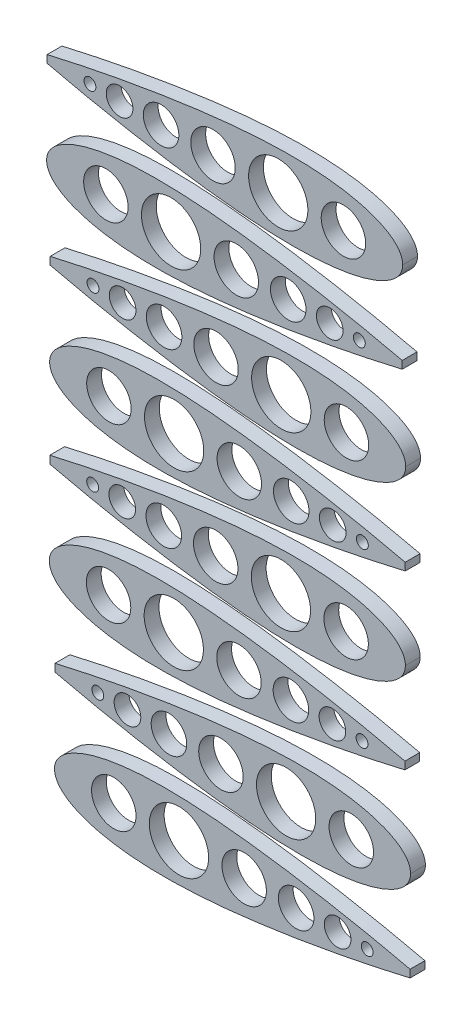
from build123d import *

# Parameters (mm, degrees)
SKETCH3_R             = 3
SKETCH3_R_2           = 2.4
SKETCH3_R_3           = 1.8
SKETCH3_R_4           = 4
SKETCH3_R_5           = 0.8
BOSS_EXTRUDE1_DEPTH   = 1
BOSS_EXTRUDE1_2_DEPTH = 1
BOSS_EXTRUDE1_3_DEPTH = 1
BOSS_EXTRUDE1_4_DEPTH = 1
BOSS_EXTRUDE1_5_DEPTH = 1
BOSS_EXTRUDE1_6_DEPTH = 1
BOSS_EXTRUDE1_7_DEPTH = 1
BOSS_EXTRUDE1_8_DEPTH = 1


with BuildPart() as part:
    # Sketch3 → Boss-Extrude1 (new, symmetric)
    with BuildSketch(Plane.XY):
        with BuildLine():
            Line((45.917800755, 0.750362197), (45.919419542, -0.277439389))
            add(Edge.make_bspline(
                [(-2.082199245, 0.160860129), (-2.081952194, 0.071640867), (-2.07374013, -0.084768844), (-2.041891142, -0.310220538), (-1.961048117, -0.604515456), (-1.847691772, -0.885275938), (-1.686732692, -1.179995064), (-1.462400089, -1.497179241), (-1.152579712, -1.842870259), (-0.722454312, -2.224944594), (-0.121936459, -2.648658184), (0.698645093, -3.103588606), (1.844645331, -3.594556504), (3.285096182, -4.051191861), (5.371913829, -4.526436716), (8.086354681, -4.894221024), (11.280495111, -5.076355831), (14.941589644, -5.044041079), (18.166549217, -4.858899542), (20.927079884, -4.614673365), (23.676919792, -4.315349446), (25.972237461, -4.022299468), (28.246613105, -3.698172579), (30.998270395, -3.265896123), (33.245205712, -2.887262497), (35.562136665, -2.465232179), (38.209721056, -1.95929534), (40.601787622, -1.467978059), (42.634192546, -1.035887238), (44.696860353, -0.564398536), (45.5105022, -0.374431444), (45.919419542, -0.277439389)],
                knots=[0, 0, 0, 0, 0, 0.006442135, 0.01132528, 0.01640633, 0.022022241, 0.028284763, 0.035552492, 0.04443509, 0.055515051, 0.069795494, 0.08858812, 0.112149618, 0.145519971, 0.178890371, 0.243189394, 0.309930212, 0.376671029, 0.443411848, 0.476782258, 0.510152669, 0.576893487, 0.610263899, 0.64363431, 0.710375129, 0.743745539, 0.77711595, 0.843856766, 0.877227178, 0.910597591, 0.910597591, 0.910597591, 0.910597591, 0.910597591], degree=4))
            add(Edge.make_bspline(
                [(-2.082199245, 0.160860129), (-2.082233235, 0.250079726), (-2.074513901, 0.406514529), (-2.043375242, 0.632065428), (-1.963459645, 0.926613542), (-1.850988256, 1.207729702), (-1.690958337, 1.502954386), (-1.467625975, 1.820843636), (-1.158896059, 2.16750887), (-0.729976324, 2.550936201), (-0.130796145, 2.976539316), (0.688348309, 3.434052306), (1.832796316, 3.92862766), (3.271801623, 4.389798161), (5.357111899, 4.871614117), (8.070380766, 5.247947068), (11.263931626, 5.440142488), (14.925109787, 5.419360316), (18.150636555, 5.244378295), (20.911922837, 5.00884898), (23.662691969, 4.71818852), (25.958921356, 4.432370228), (28.234306714, 4.115409213), (30.987312019, 3.691802601), (33.235428882, 3.320248681), (35.553677732, 2.905518772), (38.202842685, 2.407924313), (40.596445029, 1.924144461), (42.630200953, 1.498457843), (44.694343712, 1.033468868), (45.508579917, 0.846065684), (45.917800755, 0.750362197)],
                knots=[0, 0, 0, 0, 0, 0.006442135, 0.01132528, 0.01640633, 0.022022241, 0.028284763, 0.035552492, 0.04443509, 0.055515051, 0.069795494, 0.08858812, 0.112149618, 0.145519971, 0.178890371, 0.243189394, 0.309930212, 0.376671029, 0.443411848, 0.476782258, 0.510152669, 0.576893487, 0.610263899, 0.64363431, 0.710375129, 0.743745539, 0.77711595, 0.843856766, 0.877227178, 0.910597591, 0.910597591, 0.910597591, 0.910597591, 0.910597591], degree=4))
        make_face()
        with Locations((5.917800755, 0.170201873)):
            Circle(SKETCH3_R, mode=Mode.SUBTRACT)
        with Locations((23.517800755, 0.19075371)):
            Circle(SKETCH3_R, mode=Mode.SUBTRACT)
        with Locations((30.531078192, 0.19894324)):
            Circle(SKETCH3_R_2, mode=Mode.SUBTRACT)
        with Locations((36.131078192, 0.205482461)):
            Circle(SKETCH3_R_3, mode=Mode.SUBTRACT)
        with Locations((14.717800755, 0.180477791)):
            Circle(SKETCH3_R_4, mode=Mode.SUBTRACT)
        with Locations((40.131078192, 0.210153333)):
            Circle(SKETCH3_R_5, mode=Mode.SUBTRACT)
    extrude(amount=BOSS_EXTRUDE1_DEPTH, both=True)


with BuildPart() as body_2:
    # Sketch3 → Boss-Extrude1 2 (new, symmetric)
    with BuildSketch(Plane.XY):
        with BuildLine():
            Line((-2.019643238, 12.538517767), (-2.021262026, 11.510716181))
            add(Edge.make_bspline(
                [(45.980356762, 11.949015699), (45.98010971, 11.859796438), (45.971897646, 11.703386726), (45.940048659, 11.477935033), (45.859205633, 11.183640115), (45.745849288, 10.902879633), (45.584890208, 10.608160506), (45.360557605, 10.290976329), (45.050737228, 9.945285311), (44.620611829, 9.563210977), (44.020093975, 9.139497386), (43.199512423, 8.684566965), (42.053512186, 8.193599066), (40.613061334, 7.736963709), (38.526243688, 7.261718855), (35.811802835, 6.893934546), (32.617662406, 6.71179974), (28.956567872, 6.744114492), (25.731608299, 6.929256029), (22.971077632, 7.173482206), (20.221237725, 7.472806125), (17.925920056, 7.765856103), (15.651544412, 8.089982992), (12.899887122, 8.522259447), (10.652951805, 8.900893074), (8.336020852, 9.322923391), (5.68843646, 9.82886023), (3.296369895, 10.320177511), (1.26396497, 10.752268333), (-0.798702837, 11.223757035), (-1.612344683, 11.413724126), (-2.021262026, 11.510716181)],
                knots=[0, 0, 0, 0, 0, 0.006442135, 0.01132528, 0.01640633, 0.022022241, 0.028284763, 0.035552492, 0.04443509, 0.055515051, 0.069795494, 0.08858812, 0.112149618, 0.145519971, 0.178890371, 0.243189394, 0.309930212, 0.376671029, 0.443411848, 0.476782258, 0.510152669, 0.576893487, 0.610263899, 0.64363431, 0.710375129, 0.743745539, 0.77711595, 0.843856766, 0.877227178, 0.910597591, 0.910597591, 0.910597591, 0.910597591, 0.910597591], degree=4))
            add(Edge.make_bspline(
                [(45.980356762, 11.949015699), (45.980390752, 12.038235297), (45.972671418, 12.1946701), (45.941532759, 12.420220999), (45.861617162, 12.714769112), (45.749145772, 12.995885272), (45.589115854, 13.291109956), (45.365783492, 13.608999206), (45.057053575, 13.95566444), (44.628133841, 14.339091771), (44.028953661, 14.764694886), (43.209809208, 15.222207876), (42.065361201, 15.716783231), (40.626355894, 16.177953731), (38.541045618, 16.659769687), (35.82777675, 17.036102638), (32.634225891, 17.228298059), (28.973047729, 17.207515886), (25.747520962, 17.032533865), (22.98623468, 16.79700455), (20.235465547, 16.50634409), (17.93923616, 16.220525799), (15.663850803, 15.903564783), (12.910845498, 15.479958171), (10.662728635, 15.108404252), (8.344479784, 14.693674342), (5.695314831, 14.196079884), (3.301712488, 13.712300031), (1.267956564, 13.286613413), (-0.796186196, 12.821624438), (-1.6104224, 12.634221254), (-2.019643238, 12.538517767)],
                knots=[0, 0, 0, 0, 0, 0.006442135, 0.01132528, 0.01640633, 0.022022241, 0.028284763, 0.035552492, 0.04443509, 0.055515051, 0.069795494, 0.08858812, 0.112149618, 0.145519971, 0.178890371, 0.243189394, 0.309930212, 0.376671029, 0.443411848, 0.476782258, 0.510152669, 0.576893487, 0.610263899, 0.64363431, 0.710375129, 0.743745539, 0.77711595, 0.843856766, 0.877227178, 0.910597591, 0.910597591, 0.910597591, 0.910597591, 0.910597591], degree=4))
        make_face()
        with Locations((3.767079325, 11.998308903)):
            Circle(SKETCH3_R_5, mode=Mode.SUBTRACT)
        with Locations((29.180356762, 11.968633362)):
            Circle(SKETCH3_R_4, mode=Mode.SUBTRACT)
        with Locations((7.767079325, 11.993638031)):
            Circle(SKETCH3_R_3, mode=Mode.SUBTRACT)
        with Locations((13.367079325, 11.987098811)):
            Circle(SKETCH3_R_2, mode=Mode.SUBTRACT)
        with Locations((20.380356762, 11.97890928)):
            Circle(SKETCH3_R, mode=Mode.SUBTRACT)
        with Locations((37.980356762, 11.958357443)):
            Circle(SKETCH3_R, mode=Mode.SUBTRACT)
    extrude(amount=BOSS_EXTRUDE1_2_DEPTH, both=True)


with BuildPart() as body_3:
    # Sketch3 → Boss-Extrude1 3 (new, symmetric)
    with BuildSketch(Plane.XY):
        with BuildLine():
            Line((45.216926206, 24.72516597), (45.218544993, 23.697364385))
            add(Edge.make_bspline(
                [(-2.783073794, 24.135663903), (-2.782826743, 24.046444641), (-2.774614679, 23.89003493), (-2.742765691, 23.664583236), (-2.661922666, 23.370288318), (-2.548566321, 23.089527836), (-2.387607241, 22.79480871), (-2.163274638, 22.477624532), (-1.853454261, 22.131933515), (-1.423328861, 21.74985918), (-0.822811008, 21.326145589), (-0.002229456, 20.871215168), (1.143770782, 20.380247269), (2.584221633, 19.923611913), (4.67103928, 19.448367058), (7.385480132, 19.08058275), (10.579620562, 18.898447943), (14.240715095, 18.930762695), (17.465674669, 19.115904232), (20.226205335, 19.360130409), (22.976045243, 19.659454328), (25.271362912, 19.952504306), (27.545738556, 20.276631195), (30.297395846, 20.70890765), (32.544331163, 21.087541277), (34.861262116, 21.509571595), (37.508846507, 22.015508434), (39.900913073, 22.506825715), (41.933317997, 22.938916536), (43.995985804, 23.410405238), (44.809627651, 23.60037233), (45.218544993, 23.697364385)],
                knots=[0, 0, 0, 0, 0, 0.006442135, 0.01132528, 0.01640633, 0.022022241, 0.028284763, 0.035552492, 0.04443509, 0.055515051, 0.069795494, 0.08858812, 0.112149618, 0.145519971, 0.178890371, 0.243189394, 0.309930212, 0.376671029, 0.443411848, 0.476782258, 0.510152669, 0.576893487, 0.610263899, 0.64363431, 0.710375129, 0.743745539, 0.77711595, 0.843856766, 0.877227178, 0.910597591, 0.910597591, 0.910597591, 0.910597591, 0.910597591], degree=4))
            add(Edge.make_bspline(
                [(-2.783073794, 24.135663903), (-2.783107784, 24.2248835), (-2.77538845, 24.381318303), (-2.744249791, 24.606869202), (-2.664334194, 24.901417315), (-2.551862805, 25.182533476), (-2.391832886, 25.47775816), (-2.168500524, 25.795647409), (-1.859770608, 26.142312644), (-1.430850873, 26.525739974), (-0.831670694, 26.95134309), (-0.01252624, 27.408856079), (1.131921767, 27.903431434), (2.570927074, 28.364601934), (4.65623735, 28.84641789), (7.369506217, 29.222750841), (10.563057077, 29.414946262), (14.224235238, 29.39416409), (17.449762006, 29.219182068), (20.211048288, 28.983652753), (22.96181742, 28.692992293), (25.258046807, 28.407174002), (27.533432165, 28.090212986), (30.28643747, 27.666606375), (32.534554333, 27.295052455), (34.852803183, 26.880322546), (37.501968136, 26.382728087), (39.89557048, 25.898948235), (41.929326404, 25.473261617), (43.993469163, 25.008272641), (44.807705368, 24.820869458), (45.216926206, 24.72516597)],
                knots=[0, 0, 0, 0, 0, 0.006442135, 0.01132528, 0.01640633, 0.022022241, 0.028284763, 0.035552492, 0.04443509, 0.055515051, 0.069795494, 0.08858812, 0.112149618, 0.145519971, 0.178890371, 0.243189394, 0.309930212, 0.376671029, 0.443411848, 0.476782258, 0.510152669, 0.576893487, 0.610263899, 0.64363431, 0.710375129, 0.743745539, 0.77711595, 0.843856766, 0.877227178, 0.910597591, 0.910597591, 0.910597591, 0.910597591, 0.910597591], degree=4))
        make_face()
        with Locations((5.216926206, 24.145005647)):
            Circle(SKETCH3_R, mode=Mode.SUBTRACT)
        with Locations((22.816926206, 24.165557483)):
            Circle(SKETCH3_R, mode=Mode.SUBTRACT)
        with Locations((29.830203643, 24.173747014)):
            Circle(SKETCH3_R_2, mode=Mode.SUBTRACT)
        with Locations((35.430203643, 24.180286235)):
            Circle(SKETCH3_R_3, mode=Mode.SUBTRACT)
        with Locations((14.016926206, 24.155281565)):
            Circle(SKETCH3_R_4, mode=Mode.SUBTRACT)
        with Locations((39.430203643, 24.184957107)):
            Circle(SKETCH3_R_5, mode=Mode.SUBTRACT)
    extrude(amount=BOSS_EXTRUDE1_3_DEPTH, both=True)


with BuildPart() as body_4:
    # Sketch3 → Boss-Extrude1 4 (new, symmetric)
    with BuildSketch(Plane.XY):
        with BuildLine():
            Line((-2.720517787, 36.513321541), (-2.722136575, 35.485519955))
            add(Edge.make_bspline(
                [(45.279482213, 35.923819473), (45.279235161, 35.834600211), (45.271023097, 35.6781905), (45.23917411, 35.452738807), (45.158331084, 35.158443888), (45.044974739, 34.877683407), (44.884015659, 34.58296428), (44.659683056, 34.265780103), (44.349862679, 33.920089085), (43.91973728, 33.538014751), (43.319219426, 33.11430116), (42.498637874, 32.659370738), (41.352637637, 32.16840284), (39.912186785, 31.711767483), (37.825369139, 31.236522629), (35.110928287, 30.86873832), (31.916787857, 30.686603513), (28.255693323, 30.718918265), (25.03073375, 30.904059803), (22.270203083, 31.148285979), (19.520363176, 31.447609898), (17.225045507, 31.740659876), (14.950669863, 32.064786765), (12.199012573, 32.497063221), (9.952077256, 32.875696848), (7.635146303, 33.297727165), (4.987561911, 33.803664004), (2.595495346, 34.294981285), (0.563090421, 34.727072106), (-1.499577386, 35.198560808), (-2.313219232, 35.3885279), (-2.722136575, 35.485519955)],
                knots=[0, 0, 0, 0, 0, 0.006442135, 0.01132528, 0.01640633, 0.022022241, 0.028284763, 0.035552492, 0.04443509, 0.055515051, 0.069795494, 0.08858812, 0.112149618, 0.145519971, 0.178890371, 0.243189394, 0.309930212, 0.376671029, 0.443411848, 0.476782258, 0.510152669, 0.576893487, 0.610263899, 0.64363431, 0.710375129, 0.743745539, 0.77711595, 0.843856766, 0.877227178, 0.910597591, 0.910597591, 0.910597591, 0.910597591, 0.910597591], degree=4))
            add(Edge.make_bspline(
                [(45.279482213, 35.923819473), (45.279516203, 36.01303907), (45.271796869, 36.169473873), (45.24065821, 36.395024773), (45.160742613, 36.689572886), (45.048271223, 36.970689046), (44.888241305, 37.26591373), (44.664908943, 37.58380298), (44.356179026, 37.930468214), (43.927259292, 38.313895545), (43.328079112, 38.73949866), (42.508934659, 39.19701165), (41.364486652, 39.691587005), (39.925481345, 40.152757505), (37.840171069, 40.634573461), (35.126902201, 41.010906412), (31.933351342, 41.203101832), (28.27217318, 41.18231966), (25.046646413, 41.007337639), (22.285360131, 40.771808324), (19.534590998, 40.481147864), (17.238361611, 40.195329572), (14.962976254, 39.878368557), (12.209970949, 39.454761945), (9.961854086, 39.083208026), (7.643605235, 38.668478116), (4.994440282, 38.170883657), (2.600837939, 37.687103805), (0.567082015, 37.261417187), (-1.497060745, 36.796428212), (-2.311296949, 36.609025028), (-2.720517787, 36.513321541)],
                knots=[0, 0, 0, 0, 0, 0.006442135, 0.01132528, 0.01640633, 0.022022241, 0.028284763, 0.035552492, 0.04443509, 0.055515051, 0.069795494, 0.08858812, 0.112149618, 0.145519971, 0.178890371, 0.243189394, 0.309930212, 0.376671029, 0.443411848, 0.476782258, 0.510152669, 0.576893487, 0.610263899, 0.64363431, 0.710375129, 0.743745539, 0.77711595, 0.843856766, 0.877227178, 0.910597591, 0.910597591, 0.910597591, 0.910597591, 0.910597591], degree=4))
        make_face()
        with Locations((3.066204776, 35.973112677)):
            Circle(SKETCH3_R_5, mode=Mode.SUBTRACT)
        with Locations((28.479482213, 35.943437135)):
            Circle(SKETCH3_R_4, mode=Mode.SUBTRACT)
        with Locations((7.066204776, 35.968441805)):
            Circle(SKETCH3_R_3, mode=Mode.SUBTRACT)
        with Locations((12.666204776, 35.961902584)):
            Circle(SKETCH3_R_2, mode=Mode.SUBTRACT)
        with Locations((19.679482213, 35.953713054)):
            Circle(SKETCH3_R, mode=Mode.SUBTRACT)
        with Locations((37.279482213, 35.933161217)):
            Circle(SKETCH3_R, mode=Mode.SUBTRACT)
    extrude(amount=BOSS_EXTRUDE1_4_DEPTH, both=True)


with BuildPart() as body_5:
    # Sketch3 → Boss-Extrude1 5 (new, symmetric)
    with BuildSketch(Plane.XY):
        with BuildLine():
            Line((45.26192229, 47.996607663), (45.263541077, 46.968806077))
            add(Edge.make_bspline(
                [(-2.73807771, 47.407105596), (-2.737830659, 47.317886334), (-2.729618595, 47.161476623), (-2.697769607, 46.936024929), (-2.616926582, 46.641730011), (-2.503570237, 46.360969529), (-2.342611157, 46.066250403), (-2.118278554, 45.749066225), (-1.808458177, 45.403375208), (-1.378332777, 45.021300873), (-0.777814924, 44.597587282), (0.042766628, 44.142656861), (1.188766866, 43.651688962), (2.629217717, 43.195053606), (4.716035364, 42.719808751), (7.430476216, 42.352024443), (10.624616646, 42.169889636), (14.285711179, 42.202204388), (17.510670752, 42.387345925), (20.271201419, 42.631572102), (23.021041327, 42.930896021), (25.316358996, 43.223945999), (27.59073464, 43.548072888), (30.34239193, 43.980349343), (32.589327247, 44.35898297), (34.9062582, 44.781013288), (37.553842591, 45.286950127), (39.945909157, 45.778267408), (41.978314081, 46.210358229), (44.040981888, 46.681846931), (44.854623735, 46.871814022), (45.263541077, 46.968806077)],
                knots=[0, 0, 0, 0, 0, 0.006442135, 0.01132528, 0.01640633, 0.022022241, 0.028284763, 0.035552492, 0.04443509, 0.055515051, 0.069795494, 0.08858812, 0.112149618, 0.145519971, 0.178890371, 0.243189394, 0.309930212, 0.376671029, 0.443411848, 0.476782258, 0.510152669, 0.576893487, 0.610263899, 0.64363431, 0.710375129, 0.743745539, 0.77711595, 0.843856766, 0.877227178, 0.910597591, 0.910597591, 0.910597591, 0.910597591, 0.910597591], degree=4))
            add(Edge.make_bspline(
                [(-2.73807771, 47.407105596), (-2.7381117, 47.496325193), (-2.730392366, 47.652759996), (-2.699253707, 47.878310895), (-2.61933811, 48.172859008), (-2.506866721, 48.453975169), (-2.346836802, 48.749199853), (-2.12350444, 49.067089102), (-1.814774524, 49.413754337), (-1.38585479, 49.797181667), (-0.78667461, 50.222784783), (0.032469844, 50.680297772), (1.17691785, 51.174873127), (2.615923158, 51.636043627), (4.701233434, 52.117859583), (7.414502301, 52.494192534), (10.608053161, 52.686387955), (14.269231322, 52.665605783), (17.49475809, 52.490623761), (20.256044372, 52.255094446), (23.006813504, 51.964433986), (25.303042891, 51.678615695), (27.578428249, 51.361654679), (30.331433554, 50.938048068), (32.579550417, 50.566494148), (34.897799267, 50.151764239), (37.54696422, 49.65416978), (39.940566564, 49.170389928), (41.974322488, 48.74470331), (44.038465247, 48.279714334), (44.852701452, 48.092311151), (45.26192229, 47.996607663)],
                knots=[0, 0, 0, 0, 0, 0.006442135, 0.01132528, 0.01640633, 0.022022241, 0.028284763, 0.035552492, 0.04443509, 0.055515051, 0.069795494, 0.08858812, 0.112149618, 0.145519971, 0.178890371, 0.243189394, 0.309930212, 0.376671029, 0.443411848, 0.476782258, 0.510152669, 0.576893487, 0.610263899, 0.64363431, 0.710375129, 0.743745539, 0.77711595, 0.843856766, 0.877227178, 0.910597591, 0.910597591, 0.910597591, 0.910597591, 0.910597591], degree=4))
        make_face()
        with Locations((5.26192229, 47.41644734)):
            Circle(SKETCH3_R, mode=Mode.SUBTRACT)
        with Locations((22.86192229, 47.436999176)):
            Circle(SKETCH3_R, mode=Mode.SUBTRACT)
        with Locations((29.875199727, 47.445188707)):
            Circle(SKETCH3_R_2, mode=Mode.SUBTRACT)
        with Locations((35.475199727, 47.451727928)):
            Circle(SKETCH3_R_3, mode=Mode.SUBTRACT)
        with Locations((14.06192229, 47.426723258)):
            Circle(SKETCH3_R_4, mode=Mode.SUBTRACT)
        with Locations((39.475199727, 47.4563988)):
            Circle(SKETCH3_R_5, mode=Mode.SUBTRACT)
    extrude(amount=BOSS_EXTRUDE1_5_DEPTH, both=True)


with BuildPart() as body_6:
    # Sketch3 → Boss-Extrude1 6 (new, symmetric)
    with BuildSketch(Plane.XY):
        with BuildLine():
            Line((-2.675521703, 59.784763234), (-2.677140491, 58.756961648))
            add(Edge.make_bspline(
                [(45.324478297, 59.195261166), (45.324231245, 59.106041904), (45.316019181, 58.949632193), (45.284170194, 58.724180499), (45.203327168, 58.429885581), (45.089970823, 58.1491251), (44.929011743, 57.854405973), (44.70467914, 57.537221796), (44.394858763, 57.191530778), (43.964733364, 56.809456443), (43.36421551, 56.385742853), (42.543633958, 55.930812431), (41.397633721, 55.439844533), (39.957182869, 54.983209176), (37.870365223, 54.507964321), (35.15592437, 54.140180013), (31.961783941, 53.958045206), (28.300689407, 53.990359958), (25.075729834, 54.175501495), (22.315199167, 54.419727672), (19.56535926, 54.719051591), (17.270041591, 55.012101569), (14.995665947, 55.336228458), (12.244008657, 55.768504914), (9.99707334, 56.147138541), (7.680142387, 56.569168858), (5.032557995, 57.075105697), (2.64049143, 57.566422978), (0.608086505, 57.998513799), (-1.454581302, 58.470002501), (-2.268223148, 58.659969593), (-2.677140491, 58.756961648)],
                knots=[0, 0, 0, 0, 0, 0.006442135, 0.01132528, 0.01640633, 0.022022241, 0.028284763, 0.035552492, 0.04443509, 0.055515051, 0.069795494, 0.08858812, 0.112149618, 0.145519971, 0.178890371, 0.243189394, 0.309930212, 0.376671029, 0.443411848, 0.476782258, 0.510152669, 0.576893487, 0.610263899, 0.64363431, 0.710375129, 0.743745539, 0.77711595, 0.843856766, 0.877227178, 0.910597591, 0.910597591, 0.910597591, 0.910597591, 0.910597591], degree=4))
            add(Edge.make_bspline(
                [(45.324478297, 59.195261166), (45.324512286, 59.284480763), (45.316792953, 59.440915566), (45.285654294, 59.666466465), (45.205738697, 59.961014579), (45.093267307, 60.242130739), (44.933237389, 60.537355423), (44.709905026, 60.855244673), (44.40117511, 61.201909907), (43.972255376, 61.585337238), (43.373075196, 62.010940353), (42.553930743, 62.468453343), (41.409482736, 62.963028698), (39.970477429, 63.424199198), (37.885167153, 63.906015154), (35.171898285, 64.282348105), (31.978347426, 64.474543525), (28.317169264, 64.453761353), (25.091642497, 64.278779332), (22.330356215, 64.043250017), (19.579587082, 63.752589557), (17.283357695, 63.466771265), (15.007972338, 63.14981025), (12.254967032, 62.726203638), (10.00685017, 62.354649719), (7.688601319, 61.939919809), (5.039436366, 61.44232535), (2.645834023, 60.958545498), (0.612078099, 60.53285888), (-1.452064661, 60.067869905), (-2.266300865, 59.880466721), (-2.675521703, 59.784763234)],
                knots=[0, 0, 0, 0, 0, 0.006442135, 0.01132528, 0.01640633, 0.022022241, 0.028284763, 0.035552492, 0.04443509, 0.055515051, 0.069795494, 0.08858812, 0.112149618, 0.145519971, 0.178890371, 0.243189394, 0.309930212, 0.376671029, 0.443411848, 0.476782258, 0.510152669, 0.576893487, 0.610263899, 0.64363431, 0.710375129, 0.743745539, 0.77711595, 0.843856766, 0.877227178, 0.910597591, 0.910597591, 0.910597591, 0.910597591, 0.910597591], degree=4))
        make_face()
        with Locations((3.11120086, 59.24455437)):
            Circle(SKETCH3_R_5, mode=Mode.SUBTRACT)
        with Locations((28.524478297, 59.214878828)):
            Circle(SKETCH3_R_4, mode=Mode.SUBTRACT)
        with Locations((7.11120086, 59.239883498)):
            Circle(SKETCH3_R_3, mode=Mode.SUBTRACT)
        with Locations((12.71120086, 59.233344277)):
            Circle(SKETCH3_R_2, mode=Mode.SUBTRACT)
        with Locations((19.724478297, 59.225154747)):
            Circle(SKETCH3_R, mode=Mode.SUBTRACT)
        with Locations((37.324478297, 59.20460291)):
            Circle(SKETCH3_R, mode=Mode.SUBTRACT)
    extrude(amount=BOSS_EXTRUDE1_6_DEPTH, both=True)


with BuildPart() as body_7:
    # Sketch3 → Boss-Extrude1 7 (new, symmetric)
    with BuildSketch(Plane.XY):
        with BuildLine():
            Line((44.854186149, 71.383351959), (44.855804936, 70.355550373))
            add(Edge.make_bspline(
                [(-3.145813851, 70.793849891), (-3.145566799, 70.704630629), (-3.137354736, 70.548220918), (-3.105505748, 70.322769224), (-3.024662723, 70.028474306), (-2.911306377, 69.747713824), (-2.750347298, 69.452994698), (-2.526014695, 69.135810521), (-2.216194317, 68.790119503), (-1.786068918, 68.408045168), (-1.185551065, 67.984331578), (-0.364969512, 67.529401156), (0.781030725, 67.038433258), (2.221481577, 66.581797901), (4.308299223, 66.106553046), (7.022740075, 65.738768738), (10.216880505, 65.556633931), (13.877975039, 65.588948683), (17.102934612, 65.77409022), (19.863465279, 66.018316397), (22.613305186, 66.317640316), (24.908622855, 66.610690294), (27.182998499, 66.934817183), (29.934655789, 67.367093639), (32.181591106, 67.745727265), (34.498522059, 68.167757583), (37.146106451, 68.673694422), (39.538173016, 69.165011703), (41.570577941, 69.597102524), (43.633245748, 70.068591226), (44.446887594, 70.258558318), (44.855804936, 70.355550373)],
                knots=[0, 0, 0, 0, 0, 0.006442135, 0.01132528, 0.01640633, 0.022022241, 0.028284763, 0.035552492, 0.04443509, 0.055515051, 0.069795494, 0.08858812, 0.112149618, 0.145519971, 0.178890371, 0.243189394, 0.309930212, 0.376671029, 0.443411848, 0.476782258, 0.510152669, 0.576893487, 0.610263899, 0.64363431, 0.710375129, 0.743745539, 0.77711595, 0.843856766, 0.877227178, 0.910597591, 0.910597591, 0.910597591, 0.910597591, 0.910597591], degree=4))
            add(Edge.make_bspline(
                [(-3.145813851, 70.793849891), (-3.145847841, 70.883069488), (-3.138128507, 71.039504291), (-3.106989848, 71.26505519), (-3.027074251, 71.559603304), (-2.914602861, 71.840719464), (-2.754572943, 72.135944148), (-2.531240581, 72.453833398), (-2.222510665, 72.800498632), (-1.79359093, 73.183925963), (-1.194410751, 73.609529078), (-0.375266297, 74.067042068), (0.76918171, 74.561617422), (2.208187017, 75.022787923), (4.293497293, 75.504603878), (7.006766161, 75.88093683), (10.20031702, 76.07313225), (13.861495181, 76.052350078), (17.087021949, 75.877368057), (19.848308231, 75.641838742), (22.599077363, 75.351178282), (24.89530675, 75.06535999), (27.170692108, 74.748398975), (29.923697413, 74.324792363), (32.171814276, 73.953238443), (34.490063126, 73.538508534), (37.13922808, 73.040914075), (39.532830423, 72.557134223), (41.566586347, 72.131447605), (43.630729106, 71.66645863), (44.444965311, 71.479055446), (44.854186149, 71.383351959)],
                knots=[0, 0, 0, 0, 0, 0.006442135, 0.01132528, 0.01640633, 0.022022241, 0.028284763, 0.035552492, 0.04443509, 0.055515051, 0.069795494, 0.08858812, 0.112149618, 0.145519971, 0.178890371, 0.243189394, 0.309930212, 0.376671029, 0.443411848, 0.476782258, 0.510152669, 0.576893487, 0.610263899, 0.64363431, 0.710375129, 0.743745539, 0.77711595, 0.843856766, 0.877227178, 0.910597591, 0.910597591, 0.910597591, 0.910597591, 0.910597591], degree=4))
        make_face()
        with Locations((4.854186149, 70.803191635)):
            Circle(SKETCH3_R, mode=Mode.SUBTRACT)
        with Locations((22.454186149, 70.823743472)):
            Circle(SKETCH3_R, mode=Mode.SUBTRACT)
        with Locations((29.467463586, 70.831933002)):
            Circle(SKETCH3_R_2, mode=Mode.SUBTRACT)
        with Locations((35.067463586, 70.838472223)):
            Circle(SKETCH3_R_3, mode=Mode.SUBTRACT)
        with Locations((13.654186149, 70.813467553)):
            Circle(SKETCH3_R_4, mode=Mode.SUBTRACT)
        with Locations((39.067463586, 70.843143095)):
            Circle(SKETCH3_R_5, mode=Mode.SUBTRACT)
    extrude(amount=BOSS_EXTRUDE1_7_DEPTH, both=True)


with BuildPart() as body_8:
    # Sketch3 → Boss-Extrude1 8 (new, symmetric)
    with BuildSketch(Plane.XY):
        with BuildLine():
            Line((-3.083257844, 83.171507529), (-3.084876631, 82.143705943))
            add(Edge.make_bspline(
                [(44.916742156, 82.582005461), (44.916495105, 82.4927862), (44.908283041, 82.336376488), (44.876434053, 82.110924795), (44.795591028, 81.816629876), (44.682234683, 81.535869395), (44.521275603, 81.241150268), (44.296943, 80.923966091), (43.987122623, 80.578275073), (43.556997223, 80.196200739), (42.95647937, 79.772487148), (42.135897818, 79.317556727), (40.98989758, 78.826588828), (39.549446728, 78.369953471), (37.462629082, 77.894708617), (34.74818823, 77.526924308), (31.5540478, 77.344789502), (27.892953266, 77.377104254), (24.667993693, 77.562245791), (21.907463026, 77.806471967), (19.157623119, 78.105795887), (16.86230545, 78.398845865), (14.587929806, 78.722972754), (11.836272516, 79.155249209), (9.589337199, 79.533882836), (7.272406246, 79.955913153), (4.624821855, 80.461849992), (2.232755289, 80.953167273), (0.200350365, 81.385258095), (-1.862317443, 81.856746797), (-2.675959289, 82.046713888), (-3.084876631, 82.143705943)],
                knots=[0, 0, 0, 0, 0, 0.006442135, 0.01132528, 0.01640633, 0.022022241, 0.028284763, 0.035552492, 0.04443509, 0.055515051, 0.069795494, 0.08858812, 0.112149618, 0.145519971, 0.178890371, 0.243189394, 0.309930212, 0.376671029, 0.443411848, 0.476782258, 0.510152669, 0.576893487, 0.610263899, 0.64363431, 0.710375129, 0.743745539, 0.77711595, 0.843856766, 0.877227178, 0.910597591, 0.910597591, 0.910597591, 0.910597591, 0.910597591], degree=4))
            add(Edge.make_bspline(
                [(44.916742156, 82.582005461), (44.916776146, 82.671225059), (44.909056812, 82.827659862), (44.877918153, 83.053210761), (44.798002556, 83.347758874), (44.685531166, 83.628875034), (44.525501248, 83.924099718), (44.302168886, 84.241988968), (43.99343897, 84.588654202), (43.564519235, 84.972081533), (42.965339056, 85.397684648), (42.146194602, 85.855197638), (41.001746595, 86.349772993), (39.562741288, 86.810943493), (37.477431012, 87.292759449), (34.764162144, 87.6690924), (31.570611285, 87.861287821), (27.909433124, 87.840505648), (24.683906356, 87.665523627), (21.922620074, 87.429994312), (19.171850942, 87.139333852), (16.875621555, 86.853515561), (14.600236197, 86.536554545), (11.847230892, 86.112947933), (9.599114029, 85.741394014), (7.280865179, 85.326664104), (4.631700225, 84.829069646), (2.238097882, 84.345289793), (0.204341958, 83.919603175), (-1.859800801, 83.4546142), (-2.674037006, 83.267211016), (-3.083257844, 83.171507529)],
                knots=[0, 0, 0, 0, 0, 0.006442135, 0.01132528, 0.01640633, 0.022022241, 0.028284763, 0.035552492, 0.04443509, 0.055515051, 0.069795494, 0.08858812, 0.112149618, 0.145519971, 0.178890371, 0.243189394, 0.309930212, 0.376671029, 0.443411848, 0.476782258, 0.510152669, 0.576893487, 0.610263899, 0.64363431, 0.710375129, 0.743745539, 0.77711595, 0.843856766, 0.877227178, 0.910597591, 0.910597591, 0.910597591, 0.910597591, 0.910597591], degree=4))
        make_face()
        with Locations((2.703464719, 82.631298665)):
            Circle(SKETCH3_R_5, mode=Mode.SUBTRACT)
        with Locations((28.116742156, 82.601623124)):
            Circle(SKETCH3_R_4, mode=Mode.SUBTRACT)
        with Locations((6.703464719, 82.626627793)):
            Circle(SKETCH3_R_3, mode=Mode.SUBTRACT)
        with Locations((12.303464719, 82.620088572)):
            Circle(SKETCH3_R_2, mode=Mode.SUBTRACT)
        with Locations((19.316742156, 82.611899042)):
            Circle(SKETCH3_R, mode=Mode.SUBTRACT)
        with Locations((36.916742156, 82.591347205)):
            Circle(SKETCH3_R, mode=Mode.SUBTRACT)
    extrude(amount=BOSS_EXTRUDE1_8_DEPTH, both=True)


solid = Compound([part.part, body_2.part, body_3.part, body_4.part, body_5.part, body_6.part, body_7.part, body_8.part])
